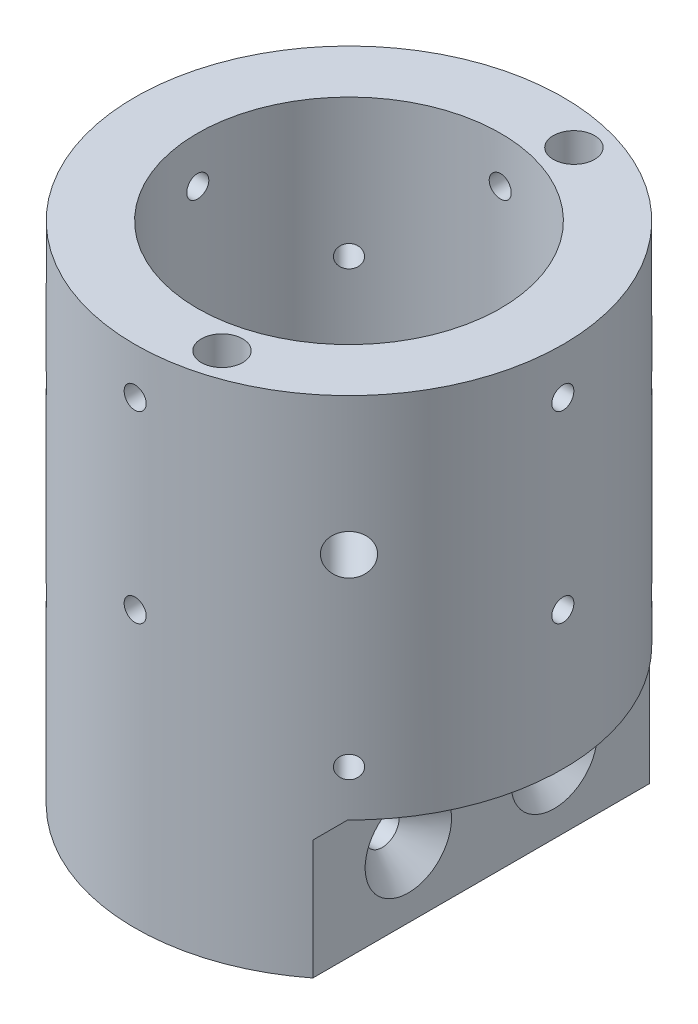
from build123d import *

# Parameters (mm, degrees)
SKETCH_1_R                       = 23.3
EXTRUDE_1_DEPTH                  = 5
SKETCH_2_R                       = 23.3
SKETCH_2_R_2                     = 16.5
EXTRUDE_2_DEPTH                  = 35
CHAMFER_8_SIZE                   = 2
SKETCH_3_R                       = 1.2
CUT_EXTRUDE_1_DEPTH              = 52.824511575
CUT_EXTRUDE_START                = -16.3
SKETCH_4_R                       = 1.2
CUT_EXTRUDE_2_DEPTH              = 36.524511747
PATTERN_CIRCULAR_1_COUNT         = 4
PATTERN_CIRCULAR_2_COUNT         = 4
PATTERN_LINEAR_3_COUNT           = 2
PATTERN_LINEAR_3_PITCH           = 20
PATTERN_START                    = -16.3
PATTERN_LINEAR_3_COPY_1_SKETCH_R = 1.2
PATTERN_LINEAR_3_COPY_1_DEPTH    = 36.524511747
PATTERN_LINEAR_3_COPY_2_SKETCH_R = 1.2
PATTERN_LINEAR_3_COPY_2_DEPTH    = 36.524511747
PATTERN_LINEAR_3_COPY_3_SKETCH_R = 1.2
PATTERN_LINEAR_3_COPY_3_DEPTH    = 36.524511747
PATTERN_LINEAR_4_COUNT           = 2
PATTERN_LINEAR_4_PITCH           = 20
PATTERN_LINEAR_4_COPY_1_SKETCH_R = 1.2
PATTERN_LINEAR_4_COPY_1_DEPTH    = 52.824511575
PATTERN_LINEAR_4_COPY_2_SKETCH_R = 1.2
PATTERN_LINEAR_4_COPY_2_DEPTH    = 52.824511575
PATTERN_LINEAR_4_COPY_3_SKETCH_R = 1.2
PATTERN_LINEAR_4_COPY_3_DEPTH    = 52.824511575
EXTRUDE_START                    = 15
EXTRUDE_3_DEPTH                  = 15
CUT_EXTRUDE_10_DEPTH             = 15
CHAMFER_4_SIZE                   = 2
CHAMFER_6_SIZE                   = 2
CHAMFER_7_SIZE                   = 2
HOLE_WIZARD_M41_D                = 3.7
HOLE_WIZARD_M41_CSINK_D          = 9.4
HOLE_WIZARD_M41_CSINK_ANGLE      = 90
SKETCH_17_R                      = 2.5
CUT_EXTRUDE_11_DEPTH             = 86
SKETCH_18_R                      = 2.2
SKETCH_18_R_2                    = 1.2
CUT_EXTRUDE_12_DEPTH             = 86
SKETCH_21_R                      = 2.25
CUT_EXTRUDE_13_DEPTH             = 65.115364935


with BuildPart() as part:
    # Эскиз1 → Бобышка-Вытянуть1 (new body)
    with BuildSketch(Plane(origin=(0, 0, 0), x_dir=(1, 0, 0), z_dir=(0, 1, 0))):
        with Locations(Location((0, 0, 0), (0, 0, 270))):
            Circle(SKETCH_1_R)
    extrude(amount=EXTRUDE_1_DEPTH)

    # Эскиз2 → Бобышка-Вытянуть2 (add)
    with BuildSketch(Plane(origin=(0, 5, 0), x_dir=(1, 0, 0), z_dir=(0, 1, 0))):
        with Locations(Location((0, 0, 0), (0, 0, 270))):
            Circle(SKETCH_2_R)
        with Locations(Location((0, 0, 0), (0, 0, 270))):
            Circle(SKETCH_2_R_2, mode=Mode.SUBTRACT)
    extrude(amount=EXTRUDE_2_DEPTH)

    # Фаска8
    chamfer_8_edges = [part.edges().sort_by_distance(p)[0] for p in [
        (0, 5, -16.5),
    ]]
    chamfer(chamfer_8_edges, length=CHAMFER_8_SIZE)

    # Эскиз3 → Вырез-Вытянуть1 (cut, through all)
    with BuildSketch(Plane(origin=(0, 0, 0), x_dir=(0, 0, -1), z_dir=(1, 0, 0))):
        with Locations((0, 35)):
            Circle(SKETCH_3_R)
    cut_extrude_1 = extrude(amount=-CUT_EXTRUDE_1_DEPTH, mode=Mode.SUBTRACT)

    # Эскиз4 → Вырез-Вытянуть2 (cut, through all)
    with BuildSketch(Plane(origin=(0, 0, 0), x_dir=(0, -1, 0), z_dir=(0.7071067811865464, 0, 0.7071067811865488)).offset(CUT_EXTRUDE_START)):
        with Locations(Location((-5, 0, 0), (0, 0, 90))):
            Circle(SKETCH_4_R)
    cut_extrude_2 = extrude(amount=-CUT_EXTRUDE_2_DEPTH, mode=Mode.SUBTRACT)

    # Круговой массив1: Вырез-Вытянуть2 ×4 about axis
    pattern_circular_1_axis = Axis((0, 0, 0), (0, 1, 0))
    for i in range(1, PATTERN_CIRCULAR_1_COUNT):
        add(cut_extrude_2.rotate(pattern_circular_1_axis, i * 360 / PATTERN_CIRCULAR_1_COUNT), mode=Mode.SUBTRACT)

    # Круговой массив2: Вырез-Вытянуть1 ×4 about axis
    pattern_circular_2_axis = Axis((0, 5, 0), (0, -1, 0))
    for i in range(1, PATTERN_CIRCULAR_2_COUNT):
        add(cut_extrude_1.rotate(pattern_circular_2_axis, i * 360 / PATTERN_CIRCULAR_2_COUNT), mode=Mode.SUBTRACT)

    # Линейный массив3: Вырез-Вытянуть2 ×2
    with Locations(*[(0, i * PATTERN_LINEAR_3_PITCH, 0) for i in range(1, PATTERN_LINEAR_3_COUNT)]):
        add(cut_extrude_2, mode=Mode.SUBTRACT)

    # Линейный массив3 copy 1 sketch → Линейный массив3 copy 1 (cut, through all)
    with BuildSketch(Plane(origin=(0, 20, 0), x_dir=(0, -1, 0), z_dir=(0.7071067811865488, 0, -0.7071067811865464)).offset(PATTERN_START)):
        with Locations(Location((-5, 0, 0), (0, 0, 90))):
            Circle(PATTERN_LINEAR_3_COPY_1_SKETCH_R)
    extrude(amount=-PATTERN_LINEAR_3_COPY_1_DEPTH, mode=Mode.SUBTRACT)

    # Линейный массив3 copy 2 sketch → Линейный массив3 copy 2 (cut, through all)
    with BuildSketch(Plane(origin=(0, 20, 0), x_dir=(0, -1, 0), z_dir=(-0.7071067811865462, 0, -0.7071067811865489)).offset(PATTERN_START)):
        with Locations(Location((-5, 0, 0), (0, 0, 90))):
            Circle(PATTERN_LINEAR_3_COPY_2_SKETCH_R)
    extrude(amount=-PATTERN_LINEAR_3_COPY_2_DEPTH, mode=Mode.SUBTRACT)

    # Линейный массив3 copy 3 sketch → Линейный массив3 copy 3 (cut, through all)
    with BuildSketch(Plane(origin=(0, 20, 0), x_dir=(0, -1, 0), z_dir=(-0.7071067811865489, 0, 0.7071067811865462)).offset(PATTERN_START)):
        with Locations(Location((-5, 0, 0), (0, 0, 90))):
            Circle(PATTERN_LINEAR_3_COPY_3_SKETCH_R)
    extrude(amount=-PATTERN_LINEAR_3_COPY_3_DEPTH, mode=Mode.SUBTRACT)

    # Линейный массив4: Вырез-Вытянуть1 ×2
    with Locations(*[(0, -i * PATTERN_LINEAR_4_PITCH, 0) for i in range(1, PATTERN_LINEAR_4_COUNT)]):
        add(cut_extrude_1, mode=Mode.SUBTRACT)

    # Линейный массив4 copy 1 sketch → Линейный массив4 copy 1 (cut, through all)
    with BuildSketch(Plane(origin=(0, -20, 0), x_dir=(1, 0, 0), z_dir=(0, 0, 1))):
        with Locations((0, 35)):
            Circle(PATTERN_LINEAR_4_COPY_1_SKETCH_R)
    extrude(amount=-PATTERN_LINEAR_4_COPY_1_DEPTH, mode=Mode.SUBTRACT)

    # Линейный массив4 copy 2 sketch → Линейный массив4 copy 2 (cut, through all)
    with BuildSketch(Plane(origin=(0, -20, 0), x_dir=(0, 0, 1), z_dir=(-1, 0, 0))):
        with Locations((0, 35)):
            Circle(PATTERN_LINEAR_4_COPY_2_SKETCH_R)
    extrude(amount=-PATTERN_LINEAR_4_COPY_2_DEPTH, mode=Mode.SUBTRACT)

    # Линейный массив4 copy 3 sketch → Линейный массив4 copy 3 (cut, through all)
    with BuildSketch(Plane(origin=(0, -20, 0), x_dir=(-1, 0, 0), z_dir=(0, 0, -1))):
        with Locations((0, 35)):
            Circle(PATTERN_LINEAR_4_COPY_3_SKETCH_R)
    extrude(amount=-PATTERN_LINEAR_4_COPY_3_DEPTH, mode=Mode.SUBTRACT)

    # Эскиз12 → Бобышка-Вытянуть3 (add)
    with BuildSketch(Plane.XZ.offset(EXTRUDE_START)):
        with BuildLine():
            Line((14.39227801, 18.323545882), (14.39227801, -18.323545882))
            ThreePointArc((14.39227801, -18.323545882), (-23.3, 0), (14.39227801, 18.323545882))
        make_face()
        with BuildLine():
            Line((0, 15), (-2.783481901, 17.783481901))
            ThreePointArc((-2.783481901, 17.783481901), (-18, 0), (-2.783481901, -17.783481901))
            Line((-2.783481901, -17.783481901), (0, -15))
            Line((0, -15), (0, 15))
        make_face(mode=Mode.SUBTRACT)
    extrude(amount=-EXTRUDE_3_DEPTH)

    # Эскиз13 → Вырез-Вытянуть10 (cut)
    with BuildSketch(Plane.XZ.offset(15)):
        with BuildLine():
            Line((-2.678634034, -18.102898103), (0.3, -15.124264069))
            Line((0.3, -15.124264069), (0.3, 15.124264069))
            Line((0.3, 15.124264069), (-2.678634034, 18.102898103))
            ThreePointArc((-2.678634034, 18.102898103), (-18.3, 0), (-2.678634034, -18.102898103))
        make_face()
    extrude(amount=-CUT_EXTRUDE_10_DEPTH, mode=Mode.SUBTRACT)

    # Фаска4
    # the kernel refuses this chamfer: 2 mm, written as the material it adds along each edge
    with BuildSketch(Plane(origin=(14.39227801, 0, 23.466911858), x_dir=(-0.027495876610586494, -0.9996219169112968, 0), z_dir=(0, 0, -1))) as chamfer_4_piece_1_section:
        Polygon((CHAMFER_4_SIZE * 0.999621916911, -CHAMFER_4_SIZE * 0.0274958766106), (-CHAMFER_4_SIZE * 0.0274958766106, -CHAMFER_4_SIZE * 0.999621916911), (0, 0), align=None)
    chamfer_4_piece_1 = extrude(amount=46.933823716, mode=Mode.PRIVATE)
    chamfer_4_piece_1 = chamfer_4_piece_1 & Plane(origin=(0, -0.666162294, 0), x_dir=(0, 0, 1), z_dir=(0, -1, 0)) * Cylinder(23.3, 102, mode=Mode.PRIVATE)
    add(chamfer_4_piece_1)

    # Фаска6
    chamfer_6_edges = [part.edges().sort_by_distance(p)[0] for p in [
        (-1.189317017, 0, -16.613581086),
        (0.3, 0, 0),
        (-1.189317017, 0, 16.613581086),
        (-18.3, 0, 0),
    ]]
    chamfer(chamfer_6_edges, length=CHAMFER_6_SIZE)

    # Фаска7
    chamfer_7_edges = [part.edges().sort_by_distance(p)[0] for p in [
        (-18.3, -15, 0),
        (-1.189317017, -15, -16.613581086),
        (0.3, -15, 0),
        (-1.189317017, -15, 16.613581086),
    ]]
    chamfer(chamfer_7_edges, length=CHAMFER_7_SIZE)

    # Зенковка для винта с полупотайной головкой M41 (through all)
    with Locations(Plane(origin=(14.39227801, -676.204468703, -24.026727422), x_dir=(0, -0.1281634506045596, -0.9917530589461938), z_dir=(1, 0, 0))):
        with Locations((-117.403889111, 659.118601015), (-101.666703032, 661.152304922)):
            CounterSinkHole(HOLE_WIZARD_M41_D / 2, HOLE_WIZARD_M41_CSINK_D / 2, counter_sink_angle=HOLE_WIZARD_M41_CSINK_ANGLE)

    # Эскиз17 → Вырез-Вытянуть11 (cut)
    with BuildSketch(Plane.XZ.offset(15)):
        with Locations(Location((5.328772167, 0, 0), (0, 0, 270))):
            Circle(SKETCH_17_R)
    extrude(amount=-CUT_EXTRUDE_11_DEPTH, mode=Mode.SUBTRACT)

    # Эскиз18 → Вырез-Вытянуть12 (cut)
    with BuildSketch(Plane(origin=(0, 0, 0), x_dir=(-0.7071067811865487, 0, 0.7071067811865464), z_dir=(-0.7071067811865464, 0, -0.7071067811865487))):
        with Locations((0, 25)):
            Circle(SKETCH_18_R)
        with Locations(Location((0, 25, 0), (0, 0, 180))):
            Circle(SKETCH_18_R_2, mode=Mode.SUBTRACT)
    extrude(amount=-CUT_EXTRUDE_12_DEPTH, mode=Mode.SUBTRACT)

    # Эскиз21 → Вырез-Вытянуть13 (cut, through all)
    with BuildSketch(Plane.XZ.offset(15)):
        with Locations(Location((5.328772167, -19.149147805, 0), (0, 0, 270))):
            Circle(SKETCH_21_R)
    cut_extrude_13 = extrude(amount=-CUT_EXTRUDE_13_DEPTH, mode=Mode.SUBTRACT)

    # Зеркальное отражение1: Вырез-Вытянуть13 across plane
    add(cut_extrude_13.mirror(Plane.XY), mode=Mode.SUBTRACT)


solid = part.part
